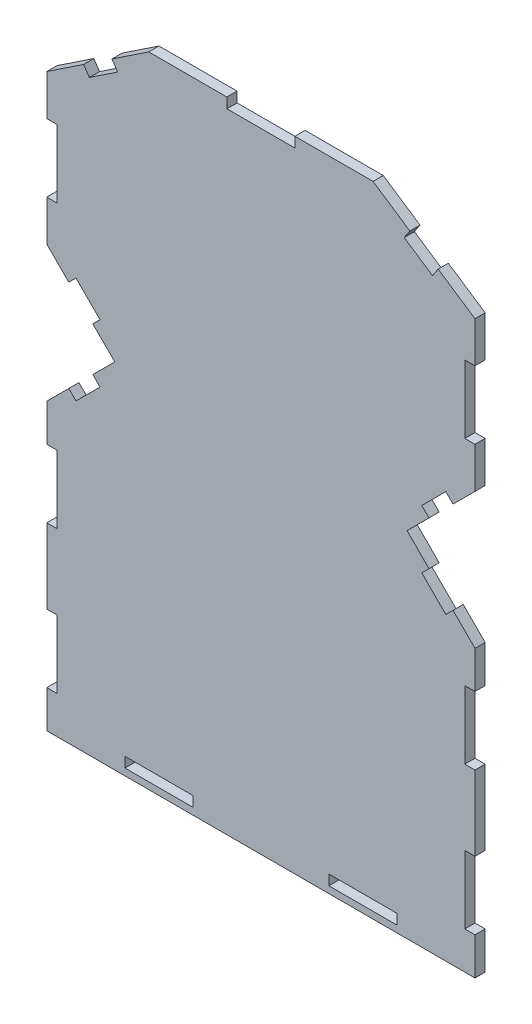
from build123d import *

# Parameters (mm, degrees)
SKETCH1_W           = 20
SKETCH1_H           = 3
BOSS_EXTRUDE1_DEPTH = 3


with BuildPart() as part:
    # Sketch1 → Boss-Extrude1 (new body)
    with BuildSketch(Plane.XY):
        Polygon((62.274694919, 0), (62.274694919, -11), (59.274694919, -11), (59.274694919, -31), (62.274694919, -31), (62.274694919, -53), (59.274694919, -53), (59.274694919, -73), (62.274694919, -73), (62.274694919, -84), (-63.725305081, -84), (-63.725305081, -73), (-60.725305081, -73), (-60.725305081, -53), (-63.725305081, -53), (-63.725305081, -31), (-60.725305081, -31), (-60.725305081, -11), (-63.725305081, -11), (-63.725305081, 0), (-57.260838987, 6.464466094), (-55.139518643, 4.343145751), (-48.068450831, 11.414213562), (-50.189771175, 13.535533906), (-43.725305081, 20), (-50.189771175, 26.464466094), (-48.068450831, 28.585786438), (-55.139518643, 35.656854249), (-57.260838987, 33.535533906), (-63.725305081, 40), (-63.725305081, 52), (-60.725305081, 52), (-60.725305081, 72), (-63.725305081, 72), (-63.725305081, 84), (-52.885556553, 91.226499019), (-51.221455964, 88.730348136), (-42.90095302, 94.277350098), (-44.565053609, 96.773500981), (-33.725305081, 104), (-10.725305081, 104), (-10.725305081, 101), (9.274694919, 101), (9.274694919, 104), (32.274694919, 104), (43.114443447, 96.773500981), (41.450342859, 94.277350098), (49.770845802, 88.730348136), (51.434946391, 91.226499019), (62.274694919, 84), (62.274694919, 72), (59.274694919, 72), (59.274694919, 52), (62.274694919, 52), (62.274694919, 40), (55.810228825, 33.535533906), (53.688908482, 35.656854249), (46.61784067, 28.585786438), (48.739161013, 26.464466094), (42.274694919, 20), (48.739161013, 13.535533906), (46.61784067, 11.414213562), (53.688908482, 4.343145751), (55.810228825, 6.464466094), align=None)
        with Locations((29.274694919, -80.5)):
            Rectangle(SKETCH1_W, SKETCH1_H, mode=Mode.SUBTRACT)
        with Locations((-30.725305081, -80.5)):
            Rectangle(SKETCH1_W, SKETCH1_H, mode=Mode.SUBTRACT)
    extrude(amount=BOSS_EXTRUDE1_DEPTH)


solid = part.part
